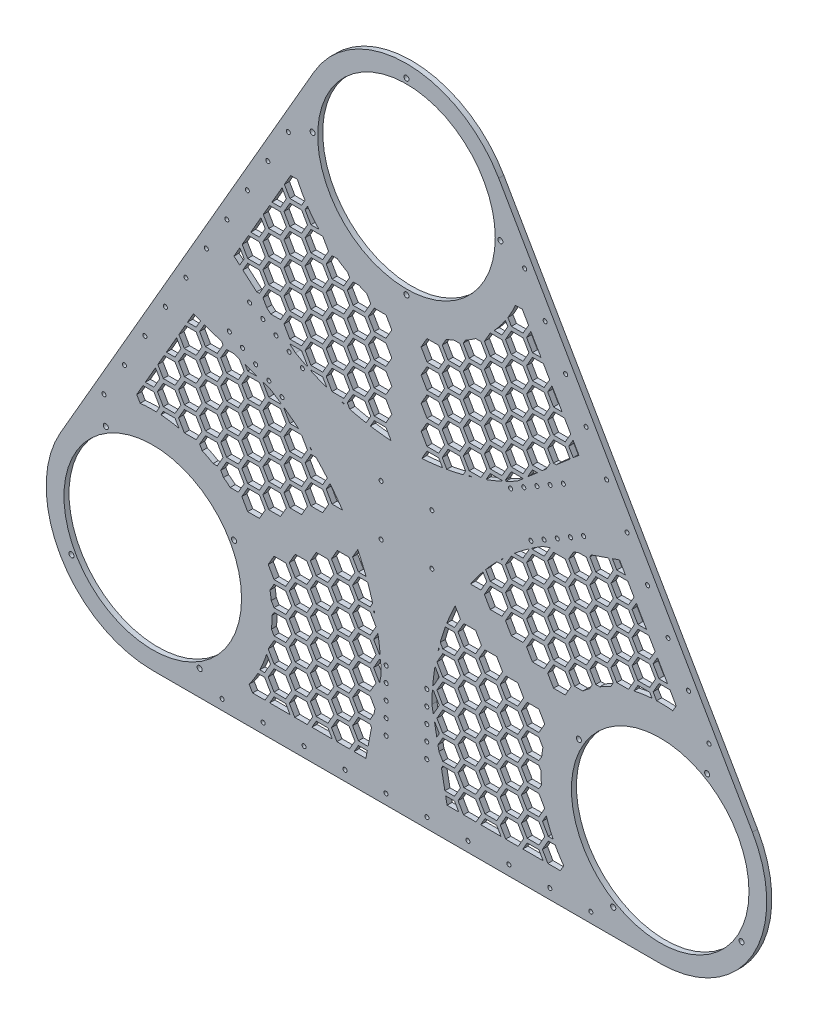
from build123d import *

# Parameters (mm, degrees)
SKETCH1_R           = 87.5
BOSS_EXTRUDE1_DEPTH = 5
SKETCH2_R           = 2.5
CUT_EXTRUDE1_DEPTH  = 531.12273258
CUT_EXTRUDE4_DEPTH  = 5
CUT_EXTRUDE5_DEPTH  = 5
CIRPATTERN1_COUNT   = 3
BOSS_EXTRUDE2_DEPTH = 5
SKETCH6_R           = 2
CUT_EXTRUDE6_DEPTH  = 531.12273258


with BuildPart() as part:
    # Sketch1 → Boss-Extrude1 (new body)
    with BuildSketch(Plane.XY):
        with BuildLine():
            Line((-90.932667397, 341.175134595), (-340.932667397, -91.837567297))
            ThreePointArc((-340.932667397, -91.837567297), (-340.932667397, -196.837567297), (-250, -249.337567297))
            Line((-250, -249.337567297), (250, -249.337567297))
            ThreePointArc((250, -249.337567297), (340.932667397, -196.837567297), (340.932667397, -91.837567297))
            Line((340.932667397, -91.837567297), (90.932667397, 341.175134595))
            ThreePointArc((90.932667397, 341.175134595), (0, 393.675134595), (-90.932667397, 341.175134595))
        make_face()
        with Locations((-250, -144.337567297)):
            Circle(SKETCH1_R, mode=Mode.SUBTRACT)
        with Locations((0, 288.675134595)):
            Circle(SKETCH1_R, mode=Mode.SUBTRACT)
        with Locations((250, -144.337567297)):
            Circle(SKETCH1_R, mode=Mode.SUBTRACT)
    extrude(amount=BOSS_EXTRUDE1_DEPTH)

    # Sketch2 → Cut-Extrude1 (cut, through all)
    with BuildSketch(Plane.XY.offset(5)):
        with Locations((0, 381.175134595)):
            Circle(SKETCH2_R)
        with Locations((92.5, 288.675134595)):
            Circle(SKETCH2_R)
        with Locations((0, 196.175134595)):
            Circle(SKETCH2_R)
        with Locations((-92.5, 288.675134595)):
            Circle(SKETCH2_R)
        with Locations((330.10734985, -190.587567297)):
            Circle(SKETCH2_R)
        with Locations((203.75, -224.444917147)):
            Circle(SKETCH2_R)
        with Locations((169.89265015, -98.087567297)):
            Circle(SKETCH2_R)
        with Locations((296.25, -64.230217447)):
            Circle(SKETCH2_R)
        with Locations((-330.10734985, -190.587567297)):
            Circle(SKETCH2_R)
        with Locations((-296.25, -64.230217447)):
            Circle(SKETCH2_R)
        with Locations((-169.89265015, -98.087567297)):
            Circle(SKETCH2_R)
        with Locations((-203.75, -224.444917147)):
            Circle(SKETCH2_R)
    extrude(amount=-CUT_EXTRUDE1_DEPTH, mode=Mode.SUBTRACT)

    # Cut-Extrude4: read off the stored shape, not the designer's step
    # Cut-Extrude4 outline → Cut-Extrude4 (cut)
    with BuildSketch(Plane.XY):
        Polygon((-136.254663529, -102), (-130.481160837, -112), (-118.934155453, -112), (-113.160652761, -102), (-118.934155453, -92), (-130.481160837, -92), align=None)
        Polygon((-11.547005384, -102), (-5.773502692, -112), (5.773502692, -112), (11.547005384, -102), (5.773502692, -92), (-5.773502692, -92), align=None)
        Polygon((30.022213998, -102), (35.79571669, -112), (47.342722074, -112), (53.116224765, -102), (47.342722074, -92), (35.79571669, -92), align=None)
        Polygon((113.160652761, -102), (118.934155453, -112), (130.481160837, -112), (136.254663529, -102), (130.481160837, -92), (118.934155453, -92), align=None)
        Polygon((71.59143338, -102), (77.364936071, -112), (88.911941455, -112), (94.685444147, -102), (88.911941455, -92), (77.364936071, -92), align=None)
        Polygon((30.022213998, -78), (35.79571669, -88), (47.342722074, -88), (53.116224765, -78), (47.342722074, -68), (35.79571669, -68), align=None)
        Polygon((-11.547005384, -78), (-5.773502692, -88), (5.773502692, -88), (11.547005384, -78), (5.773502692, -68), (-5.773502692, -68), align=None)
        Polygon((71.59143338, -78), (77.364936071, -88), (88.911941455, -88), (94.685444147, -78), (88.911941455, -68), (77.364936071, -68), align=None)
        Polygon((-94.685444147, -78), (-88.911941455, -88), (-77.364936071, -88), (-71.59143338, -78), (-77.364936071, -68), (-88.911941455, -68), align=None)
        Polygon((56.580326381, -104), (50.806823689, -114), (56.580326381, -124), (68.127331764, -124), (73.900834456, -114), (68.127331764, -104), align=None)
        Polygon((77.364936071, -140), (71.59143338, -150), (77.364936071, -160), (88.911941455, -160), (94.685444147, -150), (88.911941455, -140), align=None)
        Polygon((15.011106999, -32), (9.237604307, -42), (15.011106999, -52), (26.558112383, -52), (32.331615075, -42), (26.558112383, -32), align=None)
        Polygon((98.149545762, -176), (92.37604307, -186), (98.149545762, -196), (109.696551146, -196), (115.470053838, -186), (109.696551146, -176), align=None)
        Polygon((26.558112383, -104), (15.011106999, -104), (9.237604307, -114), (15.011106999, -124), (26.558112383, -124), (32.331615075, -114), align=None)
        Polygon((114.697808999, -219.337567297), (134.717507291, -219.337567297), (130.481160837, -212), (118.934155453, -212), align=None)
        Polygon((9.237604307, -66), (15.011106999, -76), (26.558112383, -76), (32.331615075, -66), (26.558112383, -56), (15.011106999, -56), align=None)
        Polygon((-32.331615075, -66), (-26.558112383, -76), (-15.011106999, -76), (-9.237604307, -66), (-15.011106999, -56), (-26.558112383, -56), align=None)
        Polygon((50.806823689, -66), (56.580326381, -76), (68.127331764, -76), (73.900834456, -66), (68.127331764, -56), (56.580326381, -56), align=None)
        Polygon((-73.900834456, -66), (-68.127331764, -76), (-56.580326381, -76), (-50.806823689, -66), (-56.580326381, -56), (-68.127331764, -56), align=None)
        Polygon((56.580326381, -128), (50.806823689, -138), (56.580326381, -148), (68.127331764, -148), (73.900834456, -138), (68.127331764, -128), align=None)
        Polygon((-5.773502692, -20), (-11.547005384, -30), (-5.773502692, -40), (5.773502692, -40), (11.547005384, -30), (5.773502692, -20), align=None)
        Polygon((77.364936071, -164), (71.59143338, -174), (77.364936071, -184), (88.911941455, -184), (94.685444147, -174), (88.911941455, -164), align=None)
        Polygon((98.149545762, -200), (92.37604307, -210), (97.767090063, -219.337567297), (110.079006845, -219.337567297), (115.470053838, -210), (109.696551146, -200), align=None)
        Polygon((50.806823689, -90), (56.580326381, -100), (68.127331764, -100), (73.900834456, -90), (68.127331764, -80), (56.580326381, -80), align=None)
        Polygon((9.237604307, -90), (15.011106999, -100), (26.558112383, -100), (32.331615075, -90), (26.558112383, -80), (15.011106999, -80), align=None)
        Polygon((92.37604307, -90), (98.149545762, -100), (109.696551146, -100), (115.470053838, -90), (109.696551146, -80), (98.149545762, -80), align=None)
        Polygon((-115.470053838, -90), (-109.696551146, -100), (-98.149545762, -100), (-92.37604307, -90), (-98.149545762, -80), (-109.696551146, -80), align=None)
        Polygon((35.79571669, -44), (30.022213998, -54), (35.79571669, -64), (47.342722074, -64), (53.116224765, -54), (47.342722074, -44), align=None)
        Polygon((77.364936071, -116), (71.59143338, -126), (77.364936071, -136), (88.911941455, -136), (94.685444147, -126), (88.911941455, -116), align=None)
        Polygon((98.149545762, -152), (92.37604307, -162), (98.149545762, -172), (109.696551146, -172), (115.470053838, -162), (109.696551146, -152), align=None)
        Polygon((118.934155453, -188), (113.160652761, -198), (118.934155453, -208), (130.481160837, -208), (136.254663529, -198), (130.481160837, -188), align=None)
        Polygon((47.342722074, -116), (35.79571669, -116), (30.022213998, -126), (35.79571669, -136), (47.342722074, -136), (53.116224765, -126), align=None)
        Polygon((27.436731506, -153.521812961), (29.869219222, -166.264994725), (32.331615075, -162), align=None)
        Polygon((92.37604307, -114), (98.149545762, -124), (109.696551146, -124), (115.470053838, -114), (109.696551146, -104), (98.149545762, -104), align=None)
        Polygon((47.342722074, -140), (35.79571669, -140), (30.022213998, -150), (35.79571669, -160), (47.342722074, -160), (53.116224765, -150), align=None)
        Polygon((56.580326381, -176), (50.806823689, -186), (56.580326381, -196), (68.127331764, -196), (73.900834456, -186), (68.127331764, -176), align=None)
        Polygon((-26.558112383, -32), (-32.331615075, -42), (-26.558112383, -52), (-15.011106999, -52), (-9.237604307, -42), (-15.011106999, -32), align=None)
        Polygon((73.128589617, -219.337567297), (93.14828791, -219.337567297), (88.911941455, -212), (77.364936071, -212), align=None)
        Polygon((-5.773502692, -44), (-11.547005384, -54), (-5.773502692, -64), (5.773502692, -64), (11.547005384, -54), (5.773502692, -44), align=None)
        Polygon((56.580326381, -152), (50.806823689, -162), (56.580326381, -172), (68.127331764, -172), (73.900834456, -162), (68.127331764, -152), align=None)
        Polygon((77.364936071, -188), (71.59143338, -198), (77.364936071, -208), (88.911941455, -208), (94.685444147, -198), (88.911941455, -188), align=None)
        Polygon((5.773502692, -116), (-5.773502692, -116), (-11.547005384, -126), (-5.773502692, -136), (5.773502692, -136), (11.547005384, -126), align=None)
        Polygon((-53.116224765, -54), (-47.342722074, -64), (-35.79571669, -64), (-30.022213998, -54), (-35.79571669, -44), (-47.342722074, -44), align=None)
        Polygon((15.011106999, -128), (9.237604307, -138), (10.829012052, -140.75639907), (25, -140.75639907), (26.38269787, -148), (26.558112383, -148), (32.331615075, -138), (26.558112383, -128), align=None)
        Polygon((31.016864446, -172.277214887), (31.999433921, -177.424645364), (35.79571669, -184), (47.342722074, -184), (53.116224765, -174), (47.342722074, -164), (35.79571669, -164), align=None)
        Polygon((56.580326381, -200), (50.806823689, -210), (56.197870681, -219.337567297), (68.509787464, -219.337567297), (73.900834456, -210), (68.127331764, -200), align=None)
        with BuildLine():
            Line((113.160652761, -150), (118.934155453, -160))
            Line((118.934155453, -160), (130.481160837, -160))
            Line((130.481160837, -160), (133.038216228, -155.571050145))
            ThreePointArc((133.038216228, -155.571050145), (132.615376461, -149.543348365), (132.502971843, -143.501879386))
            Line((132.502971843, -143.501879386), (130.481160837, -140))
            Line((130.481160837, -140), (118.934155453, -140))
            Line((118.934155453, -140), (113.160652761, -150))
        make_face()
        Polygon((92.37604307, -138), (98.149545762, -148), (109.696551146, -148), (115.470053838, -138), (109.696551146, -128), (98.149545762, -128), align=None)
        Polygon((47.342722074, -188), (35.79571669, -188), (34.459800119, -190.313875375), (37.835823604, -208), (47.342722074, -208), (53.116224765, -198), align=None)
        with BuildLine():
            Line((133.945262452, -186), (139.718765144, -196))
            Line((139.718765144, -196), (144.4668628, -196))
            ThreePointArc((144.4668628, -196), (140.822831367, -187.772528439), (137.819097119, -179.290321536))
            Line((137.819097119, -179.290321536), (133.945262452, -186))
        make_face()
        Polygon((38.599365319, -212), (40, -219.337567297), (51.579068528, -219.337567297), (47.342722074, -212), align=None)
        with BuildLine():
            Line((113.160652761, -126), (118.934155453, -136))
            Line((118.934155453, -136), (130.481160837, -136))
            Line((130.481160837, -136), (133.232969644, -131.233727334))
            ThreePointArc((133.232969644, -131.233727334), (133.777132444, -127.060557802), (134.47039267, -122.909552219))
            Line((134.47039267, -122.909552219), (130.481160837, -116))
            Line((130.481160837, -116), (118.934155453, -116))
            Line((118.934155453, -116), (113.160652761, -126))
        make_face()
        with BuildLine():
            Line((133.945262452, -210), (139.336309445, -219.337567297))
            Line((139.336309445, -219.337567297), (151.648226227, -219.337567297))
            Line((151.648226227, -219.337567297), (155.015447505, -213.505368963))
            ThreePointArc((155.015447505, -213.505368963), (150.538633564, -206.897031702), (146.520806025, -200))
            Line((146.520806025, -200), (139.718765144, -200))
            Line((139.718765144, -200), (133.945262452, -210))
        make_face()
        Polygon((113.160652761, -174), (118.934155453, -184), (130.481160837, -184), (136.254663529, -174), (130.481160837, -164), (118.934155453, -164), align=None)
    cut_extrude4 = extrude(amount=CUT_EXTRUDE4_DEPTH, mode=Mode.SUBTRACT)

    # Cut-Extrude5: read off the stored shape, not the designer's step
    # Cut-Extrude5 outline → Cut-Extrude5 (cut)
    with BuildSketch(Plane.XY):
        Polygon((-94.685444147, -102), (-88.911941455, -112), (-77.364936071, -112), (-71.59143338, -102), (-77.364936071, -92), (-88.911941455, -92), align=None)
        Polygon((-53.116224765, -102), (-47.342722074, -112), (-35.79571669, -112), (-30.022213998, -102), (-35.79571669, -92), (-47.342722074, -92), align=None)
        Polygon((-109.696551146, -128), (-115.470053838, -138), (-109.696551146, -148), (-98.149545762, -148), (-92.37604307, -138), (-98.149545762, -128), align=None)
        Polygon((-88.911941455, -164), (-94.685444147, -174), (-88.911941455, -184), (-77.364936071, -184), (-71.59143338, -174), (-77.364936071, -164), align=None)
        Polygon((-68.127331764, -200), (-73.900834456, -210), (-68.509787464, -219.337567297), (-56.197870681, -219.337567297), (-50.806823689, -210), (-56.580326381, -200), align=None)
        Polygon((-53.116224765, -78), (-47.342722074, -88), (-35.79571669, -88), (-30.022213998, -78), (-35.79571669, -68), (-47.342722074, -68), align=None)
        Polygon((-38.599365319, -212), (-47.342722074, -212), (-51.579068528, -219.337567297), (-40, -219.337567297), align=None)
        Polygon((-35.79571669, -164), (-47.342722074, -164), (-53.116224765, -174), (-47.342722074, -184), (-35.79571669, -184), (-31.999433921, -177.424645364), (-31.016864446, -172.277214887), align=None)
        Polygon((-15.011106999, -128), (-26.558112383, -128), (-32.331615075, -138), (-26.558112383, -148), (-26.38269787, -148), (-25, -140.75639907), (-10.829012052, -140.75639907), (-9.237604307, -138), align=None)
        Polygon((-32.331615075, -90), (-26.558112383, -100), (-15.011106999, -100), (-9.237604307, -90), (-15.011106999, -80), (-26.558112383, -80), align=None)
        Polygon((-73.900834456, -90), (-68.127331764, -100), (-56.580326381, -100), (-50.806823689, -90), (-56.580326381, -80), (-68.127331764, -80), align=None)
        Polygon((-32.331615075, -114), (-26.558112383, -124), (-15.011106999, -124), (-9.237604307, -114), (-15.011106999, -104), (-26.558112383, -104), align=None)
        Polygon((-115.470053838, -114), (-109.696551146, -124), (-98.149545762, -124), (-92.37604307, -114), (-98.149545762, -104), (-109.696551146, -104), align=None)
        Polygon((-73.900834456, -114), (-68.127331764, -124), (-56.580326381, -124), (-50.806823689, -114), (-56.580326381, -104), (-68.127331764, -104), align=None)
        Polygon((-35.79571669, -140), (-47.342722074, -140), (-53.116224765, -150), (-47.342722074, -160), (-35.79571669, -160), (-30.022213998, -150), align=None)
        Polygon((-77.364936071, -212), (-88.911941455, -212), (-93.14828791, -219.337567297), (-73.128589617, -219.337567297), align=None)
        Polygon((-56.580326381, -176), (-68.127331764, -176), (-73.900834456, -186), (-68.127331764, -196), (-56.580326381, -196), (-50.806823689, -186), align=None)
        Polygon((-35.79571669, -188), (-47.342722074, -188), (-53.116224765, -198), (-47.342722074, -208), (-37.835823604, -208), (-34.459800119, -190.313875375), align=None)
        Polygon((-56.580326381, -152), (-68.127331764, -152), (-73.900834456, -162), (-68.127331764, -172), (-56.580326381, -172), (-50.806823689, -162), align=None)
        Polygon((-35.79571669, -116), (-47.342722074, -116), (-53.116224765, -126), (-47.342722074, -136), (-35.79571669, -136), (-30.022213998, -126), align=None)
        Polygon((-77.364936071, -188), (-88.911941455, -188), (-94.685444147, -198), (-88.911941455, -208), (-77.364936071, -208), (-71.59143338, -198), align=None)
        Polygon((-56.580326381, -128), (-68.127331764, -128), (-73.900834456, -138), (-68.127331764, -148), (-56.580326381, -148), (-50.806823689, -138), align=None)
        Polygon((-98.149545762, -200), (-109.696551146, -200), (-115.470053838, -210), (-110.079006845, -219.337567297), (-97.767090063, -219.337567297), (-92.37604307, -210), align=None)
        Polygon((-94.685444147, -150), (-88.911941455, -160), (-77.364936071, -160), (-71.59143338, -150), (-77.364936071, -140), (-88.911941455, -140), align=None)
        with BuildLine():
            Line((-133.038216228, -155.571050145), (-130.481160837, -160))
            Line((-130.481160837, -160), (-118.934155453, -160))
            Line((-118.934155453, -160), (-113.160652761, -150))
            Line((-113.160652761, -150), (-118.934155453, -140))
            Line((-118.934155453, -140), (-130.481160837, -140))
            Line((-130.481160837, -140), (-132.502971843, -143.501879386))
            ThreePointArc((-132.502971843, -143.501879386), (-132.615376461, -149.543348365), (-133.038216228, -155.571050145))
        make_face()
        Polygon((-115.470053838, -162), (-109.696551146, -172), (-98.149545762, -172), (-92.37604307, -162), (-98.149545762, -152), (-109.696551146, -152), align=None)
        with BuildLine():
            ThreePointArc((-137.819097119, -179.290321536), (-140.822831367, -187.772528439), (-144.4668628, -196))
            Line((-144.4668628, -196), (-139.718765144, -196))
            Line((-139.718765144, -196), (-133.945262452, -186))
            Line((-133.945262452, -186), (-137.819097119, -179.290321536))
        make_face()
        Polygon((-115.470053838, -186), (-109.696551146, -196), (-98.149545762, -196), (-92.37604307, -186), (-98.149545762, -176), (-109.696551146, -176), align=None)
        Polygon((-94.685444147, -126), (-88.911941455, -136), (-77.364936071, -136), (-71.59143338, -126), (-77.364936071, -116), (-88.911941455, -116), align=None)
        with BuildLine():
            Line((-133.232969644, -131.233727334), (-130.481160837, -136))
            Line((-130.481160837, -136), (-118.934155453, -136))
            Line((-118.934155453, -136), (-113.160652761, -126))
            Line((-113.160652761, -126), (-118.934155453, -116))
            Line((-118.934155453, -116), (-130.481160837, -116))
            Line((-130.481160837, -116), (-134.47039267, -122.909552219))
            ThreePointArc((-134.47039267, -122.909552219), (-133.777132444, -127.060557802), (-133.232969644, -131.233727334))
        make_face()
        Polygon((-114.697808999, -219.337567297), (-118.934155453, -212), (-130.481160837, -212), (-134.717507291, -219.337567297), align=None)
        with BuildLine():
            Line((-155.015447505, -213.505368963), (-151.648226227, -219.337567297))
            Line((-151.648226227, -219.337567297), (-139.336309445, -219.337567297))
            Line((-139.336309445, -219.337567297), (-133.945262452, -210))
            Line((-133.945262452, -210), (-139.718765144, -200))
            Line((-139.718765144, -200), (-146.520806025, -200))
            ThreePointArc((-146.520806025, -200), (-150.538633564, -206.897031702), (-155.015447505, -213.505368963))
        make_face()
        Polygon((-136.254663529, -174), (-130.481160837, -184), (-118.934155453, -184), (-113.160652761, -174), (-118.934155453, -164), (-130.481160837, -164), align=None)
        Polygon((-118.934155453, -188), (-130.481160837, -188), (-136.254663529, -198), (-130.481160837, -208), (-118.934155453, -208), (-113.160652761, -198), align=None)
    cut_extrude5 = extrude(amount=CUT_EXTRUDE5_DEPTH, mode=Mode.SUBTRACT)

    # CirPattern1: Cut-Extrude4, Cut-Extrude5 ×3 about axis
    cirpattern1_axis = Axis((0, 0, 0), (0, 0, 1))
    add([cut_extrude4.rotate(cirpattern1_axis, i * 360 / CIRPATTERN1_COUNT) for i in range(1, CIRPATTERN1_COUNT)], mode=Mode.SUBTRACT)
    add([cut_extrude5.rotate(cirpattern1_axis, i * 360 / CIRPATTERN1_COUNT) for i in range(1, CIRPATTERN1_COUNT)], mode=Mode.SUBTRACT)

    # Sketch5 → Boss-Extrude2 (add, through all)
    with BuildSketch(Plane.XY.offset(5)):
        with BuildLine():
            Line((-134.39861734, 48.72756444), (-109.39861734, 92.02883463))
            ThreePointArc((-109.39861734, 92.02883463), (0, 63.64663692), (109.39861734, 92.02883463))
            Line((109.39861734, 92.02883463), (134.39861734, 48.72756444))
            ThreePointArc((134.39861734, 48.72756444), (55.119604438, -31.82331846), (25, -140.75639907))
            Line((25, -140.75639907), (-25, -140.75639907))
            ThreePointArc((-25, -140.75639907), (-55.119604438, -31.82331846), (-134.39861734, 48.72756444))
        make_face()
    extrude(amount=-BOSS_EXTRUDE2_DEPTH)

    # Sketch6 → Cut-Extrude6 (cut, through all)
    with BuildSketch(Plane.XY.offset(5)):
        with Locations((-25, 25)):
            Circle(SKETCH6_R)
        with Locations((25, 25)):
            Circle(SKETCH6_R)
        with Locations((25, -25)):
            Circle(SKETCH6_R)
        with Locations((-25, -25)):
            Circle(SKETCH6_R)
        with Locations((-20, -130)):
            Circle(SKETCH6_R)
        with Locations((20, -130)):
            Circle(SKETCH6_R)
        with Locations((20, -190)):
            Circle(SKETCH6_R)
        with Locations((-20, -190)):
            Circle(SKETCH6_R)
        with Locations((-20, -160)):
            Circle(SKETCH6_R)
        with Locations((-20, -145)):
            Circle(SKETCH6_R)
        with Locations((20, -145)):
            Circle(SKETCH6_R)
        with Locations((20, -160)):
            Circle(SKETCH6_R)
        with Locations((-20, -175)):
            Circle(SKETCH6_R)
        with Locations((20, -175)):
            Circle(SKETCH6_R)
        with Locations((-102.583302492, 82.320508076)):
            Circle(SKETCH6_R)
        with Locations((-122.583302492, 47.679491924)):
            Circle(SKETCH6_R)
        with Locations((-135.573683549, 55.179491924)):
            Circle(SKETCH6_R)
        with Locations((-115.573683549, 89.820508076)):
            Circle(SKETCH6_R)
        with Locations((-128.564064606, 97.320508076)):
            Circle(SKETCH6_R)
        with Locations((-148.564064606, 62.679491924)):
            Circle(SKETCH6_R)
        with Locations((-161.554445662, 70.179491924)):
            Circle(SKETCH6_R)
        with Locations((-141.554445662, 104.820508076)):
            Circle(SKETCH6_R)
        with Locations((-154.544826719, 112.320508076)):
            Circle(SKETCH6_R)
        with Locations((-174.544826719, 77.679491924)):
            Circle(SKETCH6_R)
        with Locations((122.583302492, 47.679491924)):
            Circle(SKETCH6_R)
        with Locations((102.583302492, 82.320508076)):
            Circle(SKETCH6_R)
        with Locations((115.573683549, 89.820508076)):
            Circle(SKETCH6_R)
        with Locations((135.573683549, 55.179491924)):
            Circle(SKETCH6_R)
        with Locations((148.564064606, 62.679491924)):
            Circle(SKETCH6_R)
        with Locations((128.564064606, 97.320508076)):
            Circle(SKETCH6_R)
        with Locations((141.554445662, 104.820508076)):
            Circle(SKETCH6_R)
        with Locations((161.554445662, 70.179491924)):
            Circle(SKETCH6_R)
        with Locations((174.544826719, 77.679491924)):
            Circle(SKETCH6_R)
        with Locations((154.544826719, 112.320508076)):
            Circle(SKETCH6_R)
        with Locations((-181.648226227, -239.337567297)):
            Circle(SKETCH6_R)
        with Locations((-141.281953732, -239.337567297)):
            Circle(SKETCH6_R)
        with Locations((-100.915681237, -239.337567297)):
            Circle(SKETCH6_R)
        with Locations((-60.549408742, -239.337567297)):
            Circle(SKETCH6_R)
        with Locations((-20.183136247, -239.337567297)):
            Circle(SKETCH6_R)
        with Locations((20.183136247, -239.337567297)):
            Circle(SKETCH6_R)
        with Locations((60.549408742, -239.337567297)):
            Circle(SKETCH6_R)
        with Locations((100.915681237, -239.337567297)):
            Circle(SKETCH6_R)
        with Locations((141.281953732, -239.337567297)):
            Circle(SKETCH6_R)
        with Locations((181.648226227, -239.337567297)):
            Circle(SKETCH6_R)
        with Locations((-116.448300246, 276.980762114)):
            Circle(SKETCH6_R)
        with Locations((-136.631436494, 242.022544677)):
            Circle(SKETCH6_R)
        with Locations((-156.814572741, 207.06432724)):
            Circle(SKETCH6_R)
        with Locations((-176.997708988, 172.106109804)):
            Circle(SKETCH6_R)
        with Locations((-197.180845236, 137.147892367)):
            Circle(SKETCH6_R)
        with Locations((-217.363981483, 102.18967493)):
            Circle(SKETCH6_R)
        with Locations((-237.547117731, 67.231457494)):
            Circle(SKETCH6_R)
        with Locations((-257.730253978, 32.273240057)):
            Circle(SKETCH6_R)
        with Locations((-277.913390226, -2.684977379)):
            Circle(SKETCH6_R)
        with Locations((-298.096526473, -37.643194816)):
            Circle(SKETCH6_R)
        with Locations((298.096526473, -37.643194816)):
            Circle(SKETCH6_R)
        with Locations((277.913390226, -2.684977379)):
            Circle(SKETCH6_R)
        with Locations((257.730253978, 32.273240057)):
            Circle(SKETCH6_R)
        with Locations((237.547117731, 67.231457494)):
            Circle(SKETCH6_R)
        with Locations((217.363981483, 102.18967493)):
            Circle(SKETCH6_R)
        with Locations((197.180845236, 137.147892367)):
            Circle(SKETCH6_R)
        with Locations((176.997708988, 172.106109804)):
            Circle(SKETCH6_R)
        with Locations((156.814572741, 207.06432724)):
            Circle(SKETCH6_R)
        with Locations((136.631436494, 242.022544677)):
            Circle(SKETCH6_R)
        with Locations((116.448300246, 276.980762114)):
            Circle(SKETCH6_R)
    extrude(amount=-CUT_EXTRUDE6_DEPTH, mode=Mode.SUBTRACT)


solid = part.part
